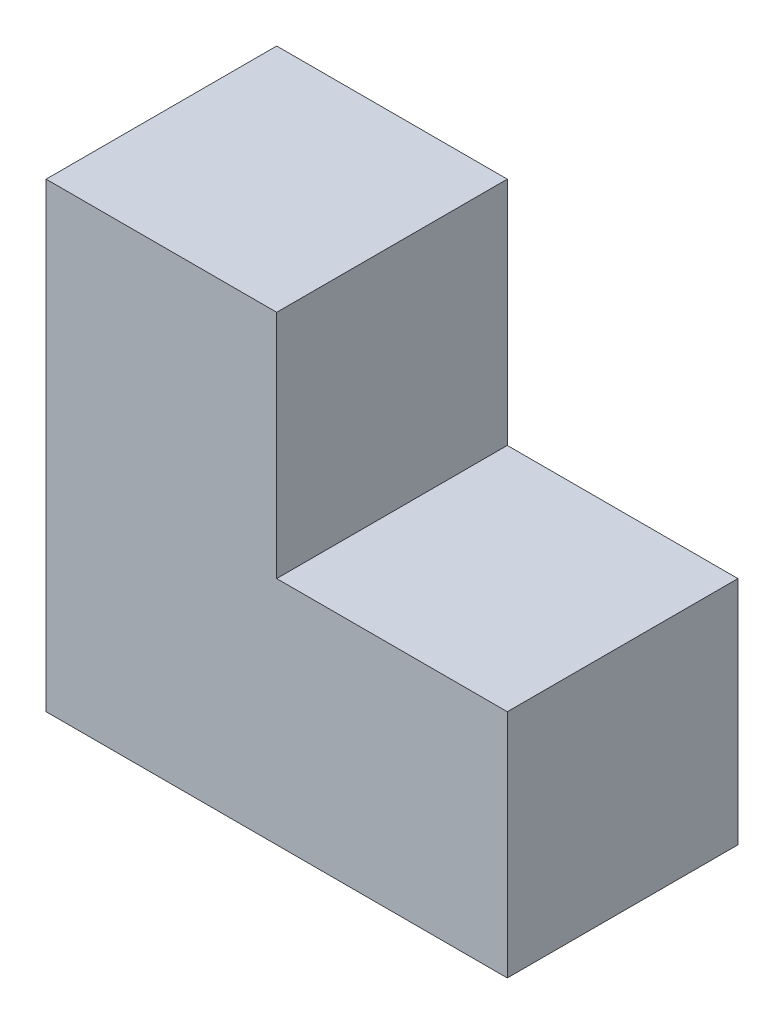
from build123d import *

# Parameters (mm, degrees)
BOSS_EXTRUDE1_DEPTH = 30


with BuildPart() as part:
    # Sketch1 → Boss-Extrude1 (new body)
    with BuildSketch(Plane.XY):
        Polygon((-68.969072165, 26.597938144), (-68.969072165, -33.402061856), (-8.969072165, -33.402061856), (-8.969072165, -3.402061856), (-38.969072165, -3.402061856), (-38.969072165, 26.597938144), align=None)
    extrude(amount=BOSS_EXTRUDE1_DEPTH)


solid = part.part
